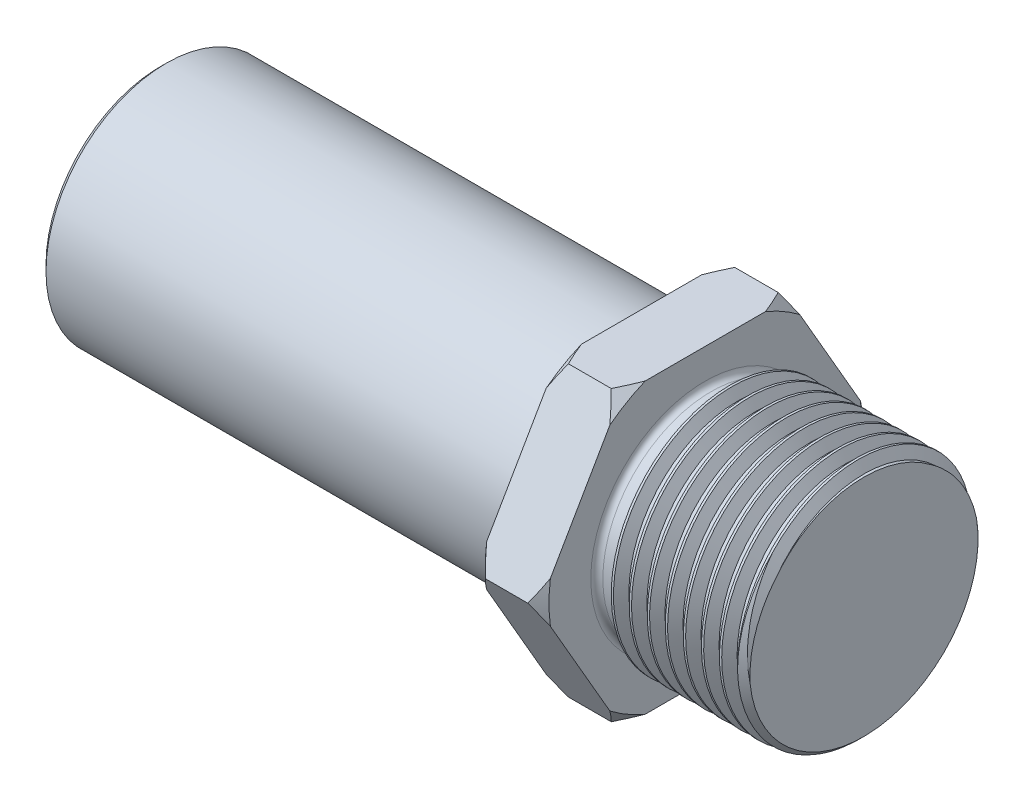
from build123d import *

# Parameters (mm, degrees)
CORTAR_EXTRUIR1_START                          = -23
CROQUIS2_R                                     = 10
CORTAR_EXTRUIR1_DEPTH                          = 23
CHAFL_N1_SIZE                                  = 0.6
CROQUIS3_R                                     = 10
SALIENTE_EXTRUIR1_DEPTH                        = 8
CROQUIS4_R                                     = 17.845841663
CORTAR_EXTRUIR2_DEPTH                          = 11.7
PERFORADOR_PARA_ROSCAR_PARA_MACHO_DE_ROS_D     = 14.5
PERFORADOR_PARA_ROSCAR_PARA_MACHO_DE_ROS_DEPTH = 15
PERFORADOR_PARA_ROSCAR_PARA_MACHO_DE_ROS_TIP   = 4.356239488
ROSCA2_PITCH                                   = 1.5
CHAFL_N2_SIZE                                  = 0.5
CHAFL_N4_SIZE                                  = 0.5
ROSCA3_PITCH                                   = 1.5
CROQUIS8_W                                     = 5.3
CROQUIS8_H                                     = 6.5
CROQUIS10_W                                    = 1.5
CROQUIS10_H                                    = 4.974707283
REDONDEO3_R                                    = 0.5
CHAFL_N3_SIZE                                  = 1
CORTAR_EXTRUIR3_DEPTH                          = 45.639767515
CORTAR_EXTRUIR3_DEPTH_BACK                     = 45.639767515
CROQUIS11_R                                    = 24.913259745
REDONDEO4_R                                    = 0.5


with BuildPart() as part:
    # Croquis1 → Revolución1 (revolve)
    with BuildSketch(Plane(origin=(0, 0, 0), x_dir=(1, 0, 0), z_dir=(0, 1, 0))):
        Polygon((0, 0), (0, 10), (-84.992006258, 10), (-85.2, 10), (-85.2, 0), align=None)
    revolve(axis=Axis((0, 0, 0), (-1, 0, 0)))

    # Croquis2 → Cortar-Extruir1 (cut)
    with BuildSketch(Plane(origin=(0, 0, 0), x_dir=(0, 0, -1), z_dir=(1, 0, 0)).offset(CORTAR_EXTRUIR1_START)):
        Circle(CROQUIS2_R)
    extrude(amount=CORTAR_EXTRUIR1_DEPTH, mode=Mode.SUBTRACT)

    # Chaflán1
    chafl_n1_edges = [part.edges().sort_by_distance(p)[0] for p in [
        (-85.2, 0, 10),
    ]]
    chamfer(chafl_n1_edges, length=CHAFL_N1_SIZE)

    # Croquis3 → Saliente-Extruir1 (add)
    with BuildSketch(Plane(origin=(-23, 0, 0), x_dir=(0, 0, -1), z_dir=(1, 0, 0))):
        Circle(CROQUIS3_R)
    extrude(amount=SALIENTE_EXTRUIR1_DEPTH)

    # Croquis4 → Cortar-Extruir2 (cut)
    with BuildSketch(Plane.ZY.offset(85.2)):
        Circle(CROQUIS4_R)
    extrude(amount=-CORTAR_EXTRUIR2_DEPTH, mode=Mode.SUBTRACT)

    # Perforador para roscar para macho de roscar para M16x1.51
    with Locations(Plane.ZY.offset(73.5)):
        with Locations((0, 0)):
            Hole(PERFORADOR_PARA_ROSCAR_PARA_MACHO_DE_ROS_D / 2, depth=PERFORADOR_PARA_ROSCAR_PARA_MACHO_DE_ROS_DEPTH)
            with Locations((0, 0, -(PERFORADOR_PARA_ROSCAR_PARA_MACHO_DE_ROS_DEPTH + PERFORADOR_PARA_ROSCAR_PARA_MACHO_DE_ROS_TIP / 2))):  # 118° drill point
                Cone(0, PERFORADOR_PARA_ROSCAR_PARA_MACHO_DE_ROS_D / 2, PERFORADOR_PARA_ROSCAR_PARA_MACHO_DE_ROS_TIP, mode=Mode.SUBTRACT)

    # Rosca2: the profile of Perfil de rosca2 profile screwed along a right-hand helix of 9.333333 turns, 8 arcs to a turn; built about Z, then put on its axis
    rosca2_z = Axis((0, 0, 0), (0, 0, 1))
    rosca2_corners = [(7.2497, 0, -0.000173205), (8.061898812, 0, 0.468749998), (8.061898812, 0, 0.656249998), (7.2497, 0, 1.125173201)]
    with BuildLine(mode=Mode.PRIVATE) as rosca2_profile:
        Line(rosca2_corners[0], rosca2_corners[1])
        Line(rosca2_corners[1], rosca2_corners[2])
        Line(rosca2_corners[2], rosca2_corners[3])
        Line(rosca2_corners[3], rosca2_corners[0])
    rosca2_cap = Face(rosca2_profile.wire())
    rosca2_turn_angles = [0, 22.5, 45, 67.5, 90, 112.5, 135, 157.5, 180, 202.5, 225, 247.5, 270, 292.5, 315, 337.5, 360]
    rosca2_turn_weights = [1, 0.9238795325112867, 1, 0.9238795325112867, 1, 0.9238795325112867, 1, 0.9238795325112867, 1, 0.9238795325112867, 1, 0.9238795325112867, 1, 0.9238795325112867, 1, 0.9238795325112867, 1]
    rosca2_turn_rails = [Edge.make_bspline([Vector(p[0], p[1], 0).rotate(rosca2_z, rosca2_turn_angles[k]) / rosca2_turn_weights[k] + Vector(0, 0, p[2] + ROSCA2_PITCH * rosca2_turn_angles[k] / 360) for k in range(17)], [0, 0, 0, 1, 1, 2, 2, 3, 3, 4, 4, 5, 5, 6, 6, 7, 7, 8, 8, 8], 2, rosca2_turn_weights) for p in rosca2_corners]
    rosca2_turn_sides = [Face.make_surface_from_curves(rosca2_turn_rails[p[0]], rosca2_turn_rails[p[1]]) for p in [(0, 1), (1, 2), (2, 3), (3, 0)]]
    rosca2_last_angles = [3240, 3262.5, 3285, 3307.5, 3330, 3345, 3360]
    rosca2_last_weights = [1, 0.9238795325112867, 1, 0.9238795325112867, 1, 0.9659258262890693, 1]
    rosca2_last_rails = [Edge.make_bspline([Vector(p[0], p[1], 0).rotate(rosca2_z, rosca2_last_angles[k]) / rosca2_last_weights[k] + Vector(0, 0, p[2] + ROSCA2_PITCH * rosca2_last_angles[k] / 360) for k in range(7)], [0, 0, 0, 1, 1, 2, 2, 3, 3, 3], 2, rosca2_last_weights) for p in rosca2_corners]
    rosca2_last_sides = [Face.make_surface_from_curves(rosca2_last_rails[p[0]], rosca2_last_rails[p[1]]) for p in [(0, 1), (1, 2), (2, 3), (3, 0)]]
    rosca2 = Plane(origin=(-73.5, 0, 0), x_dir=(0, 0, -1), z_dir=(1, 0, 0)) * Solid(Shell([*[p.moved(Location((0, 0, ROSCA2_PITCH * i))) for i in range(9) for p in rosca2_turn_sides], *rosca2_last_sides, rosca2_cap, rosca2_cap.rotate(rosca2_z, 3360).moved(Location((0, 0, ROSCA2_PITCH * 3360 / 360)))]))
    add(rosca2, mode=Mode.SUBTRACT)

    # Chaflán2
    chafl_n2_edges = [part.edges().sort_by_distance(p)[0] for p in [
        (-73.5, 0, 10),
    ]]
    chamfer(chafl_n2_edges, length=CHAFL_N2_SIZE)

    # Chaflán4
    chafl_n4_edges = [part.edges().sort_by_distance(p)[0] for p in [
        (-15, 0, 10),
    ]]
    chamfer(chafl_n4_edges, length=CHAFL_N4_SIZE)

    # Rosca3: the profile of Perfil de rosca3 profile screwed along a right-hand helix of 10 turns, 8 arcs to a turn; built about Z, then put on its axis
    rosca3_z = Axis((0, 0, 0), (0, 0, 1))
    rosca3_corners = [(10.0003, 0, -0.000173205), (10.0003, 0, 1.312673201), (9.188101188, 0, 0.843749998), (9.188101188, 0, 0.468749998)]
    with BuildLine(mode=Mode.PRIVATE) as rosca3_profile:
        Line(rosca3_corners[0], rosca3_corners[1])
        Line(rosca3_corners[1], rosca3_corners[2])
        Line(rosca3_corners[2], rosca3_corners[3])
        Line(rosca3_corners[3], rosca3_corners[0])
    rosca3_cap = Face(rosca3_profile.wire())
    rosca3_turn_angles = [0, 22.5, 45, 67.5, 90, 112.5, 135, 157.5, 180, 202.5, 225, 247.5, 270, 292.5, 315, 337.5, 360]
    rosca3_turn_weights = [1, 0.9238795325112867, 1, 0.9238795325112867, 1, 0.9238795325112867, 1, 0.9238795325112867, 1, 0.9238795325112867, 1, 0.9238795325112867, 1, 0.9238795325112867, 1, 0.9238795325112867, 1]
    rosca3_turn_rails = [Edge.make_bspline([Vector(p[0], p[1], 0).rotate(rosca3_z, rosca3_turn_angles[k]) / rosca3_turn_weights[k] + Vector(0, 0, p[2] + ROSCA3_PITCH * rosca3_turn_angles[k] / 360) for k in range(17)], [0, 0, 0, 1, 1, 2, 2, 3, 3, 4, 4, 5, 5, 6, 6, 7, 7, 8, 8, 8], 2, rosca3_turn_weights) for p in rosca3_corners]
    rosca3_turn_sides = [Face.make_surface_from_curves(rosca3_turn_rails[p[0]], rosca3_turn_rails[p[1]]) for p in [(0, 1), (1, 2), (2, 3), (3, 0)]]
    rosca3 = Plane(origin=(-12.5, 0, 0), x_dir=(0, 0, 1), z_dir=(-1, 0, 0)) * Solid(Shell([*[p.moved(Location((0, 0, ROSCA3_PITCH * i))) for i in range(10) for p in rosca3_turn_sides], rosca3_cap, rosca3_cap.rotate(rosca3_z, 3600).moved(Location((0, 0, ROSCA3_PITCH * 3600 / 360)))]))
    add(rosca3, mode=Mode.SUBTRACT)

    # Croquis8 → Revolución2 (revolve)
    with BuildSketch(Plane(origin=(0, 0, 0), x_dir=(1, 0, 0), z_dir=(0, 1, 0)), mode=Mode.PRIVATE) as revoluci_n2_sk:
        with Locations((-30.85, -10.724707283)):
            Rectangle(CROQUIS8_W, CROQUIS8_H)
    revolve(revoluci_n2_sk.sketch.rotate(Axis((-15, 0, -0.025292717), (-1, 0, 0)), 180), axis=Axis((-15, 0, -0.025292717), (-1, 0, 0)))

    # Croquis10 → Cortar-Revolución1 (revolve, cut)
    with BuildSketch(Plane(origin=(0, 0, 0), x_dir=(1, 0, 0), z_dir=(0, 1, 0))):
        with Locations((-27.45, -11.487353642)):
            Rectangle(CROQUIS10_W, CROQUIS10_H)
    revolve(axis=Axis((0, 0, 0), (-1, 0, 0)), mode=Mode.SUBTRACT)

    # Redondeo3
    redondeo3_edges = [part.edges().sort_by_distance(p)[0] for p in [
        (-28.2, 0, -9),
    ]]
    fillet(redondeo3_edges, radius=REDONDEO3_R)

    # Chaflán3
    chafl_n3_edges = [part.edges().sort_by_distance(p)[0] for p in [
        (-33.5, 0, 13.974707283),
        (-28.2, 0, 13.974707283),
    ]]
    chamfer(chafl_n3_edges, length=CHAFL_N3_SIZE)

    # Croquis11 → Cortar-Extruir3 (cut, two sides: drawn at the far end of the back side and taken through both)
    with BuildSketch(Plane.ZY.offset(33.5).offset(-CORTAR_EXTRUIR3_DEPTH_BACK)):
        Circle(CROQUIS11_R)
        Polygon((13.856406461, 0), (6.92820323, 12), (-6.92820323, 12), (-13.856406461, 0), (-6.92820323, -12), (6.92820323, -12), align=None, mode=Mode.SUBTRACT)
    extrude(amount=CORTAR_EXTRUIR3_DEPTH + CORTAR_EXTRUIR3_DEPTH_BACK, mode=Mode.SUBTRACT)

    # Redondeo4
    redondeo4_edges = [part.edges().sort_by_distance(p)[0] for p in [
        (-33.5, 0, 10),
    ]]
    fillet(redondeo4_edges, radius=REDONDEO4_R)


solid = part.part
